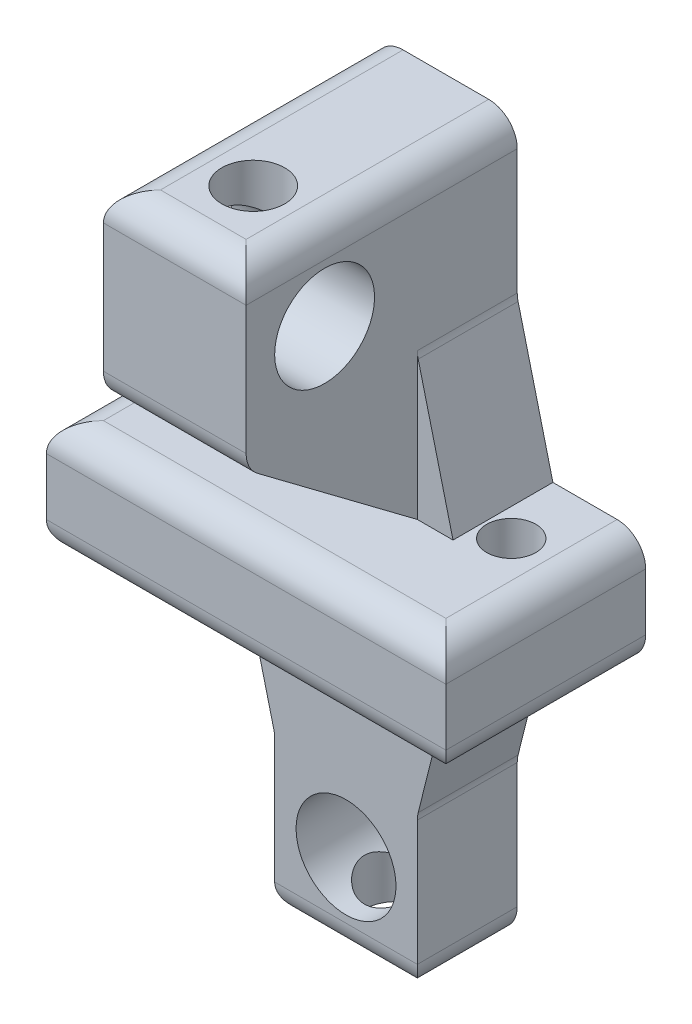
from build123d import *

# Parameters (mm, degrees)
SKETCH4_W                      = 5
SKETCH4_H                      = 3.5
BOSS_EXTRUDE4_DEPTH            = 25
SKETCH8_W                      = 5
SKETCH8_H                      = 6
BOSS_EXTRUDE6_DEPTH            = 6
BOSS_EXTRUDE8_DEPTH            = 7
BOSS_EXTRUDE8_DEPTH_BACK       = 7
SKETCH10_W                     = 7
SKETCH10_H                     = 4
CUT_EXTRUDE1_REACH             = 19.869
SKETCH11_R                     = 0.86
CUT_EXTRUDE3_REACH             = 29.094
SKETCH5_R                      = 1.75
CUT_EXTRUDE3_DIRECTION_2_REACH = 29.094
CUT_EXTRUDE2_REACH             = 29.094
SKETCH9_R                      = 1.75
CUT_EXTRUDE2_DIRECTION_2_REACH = 29.094
CUT_EXTRUDE4_REACH             = 29.094
CUT_EXTRUDE4_END_RADIUS        = 1.75
SKETCH13_R                     = 1.1
CUT_EXTRUDE5_REACH             = 29.094
CUT_EXTRUDE5_END_RADIUS        = 1.75
SKETCH14_R                     = 1.1
RIB5_REACH                     = 29.844
SKETCH19_WALL_W                = 65.188868008
SKETCH19_WALL_H                = 5
RIB8_REACH                     = 29.645
SKETCH20_WALL_W                = 62.444026
SKETCH20_WALL_H                = 3.5
RIB9_REACH                     = 29.645
SKETCH21_WALL_W                = 62.444026
SKETCH21_WALL_H                = 3.5
FILLET2_R                      = 1


with BuildPart() as part:
    # Sketch4 → Boss-Extrude4 (new body)
    with BuildSketch(Plane(origin=(0, 0, 0), x_dir=(1, 0, 0), z_dir=(0, 1, 0))):
        Rectangle(SKETCH4_W, SKETCH4_H)
    extrude(amount=BOSS_EXTRUDE4_DEPTH)

    # Sketch8 → Boss-Extrude6 (add)
    with BuildSketch(Plane.XY.offset(1.75)):
        with Locations((0, 22)):
            Rectangle(SKETCH8_W, SKETCH8_H)
    extrude(amount=BOSS_EXTRUDE6_DEPTH)

    # Sketch10 → Boss-Extrude8 (add, two sides: drawn at the far end of the back side and taken through both)
    with BuildSketch(Plane(origin=(0, 0, 0), x_dir=(0, 0, -1), z_dir=(1, 0, 0)).offset(-BOSS_EXTRUDE8_DEPTH_BACK)):
        with Locations((-1.75, 12.5)):
            Rectangle(SKETCH10_W, SKETCH10_H)
    extrude(amount=BOSS_EXTRUDE8_DEPTH + BOSS_EXTRUDE8_DEPTH_BACK)

    # Sketch11 → Cut-Extrude1 (cut, up to next)
    with BuildSketch(Plane.XZ.offset(-10.5), mode=Mode.PRIVATE) as cut_extrude1_sk1:
        with Locations(Location((-5.3, 2.3, 0), (0, 0, 270))):
            Circle(SKETCH11_R)
    cut_extrude1_tool1 = extrude(cut_extrude1_sk1.sketch, amount=-CUT_EXTRUDE1_REACH, mode=Mode.PRIVATE) & part.part
    # Sketch11 → Cut-Extrude1 (cut, up to next)
    with BuildSketch(Plane.XZ.offset(-10.5), mode=Mode.PRIVATE) as cut_extrude1_sk2:
        with Locations(Location((4.72, 0.68, 0), (0, 0, 270))):
            Circle(SKETCH11_R)
    cut_extrude1_tool2 = extrude(cut_extrude1_sk2.sketch, amount=-CUT_EXTRUDE1_REACH, mode=Mode.PRIVATE) & part.part
    add(cut_extrude1_tool1.solids().sort_by_distance((-5.3, 10.5, 2.3))[0], mode=Mode.SUBTRACT)
    add(cut_extrude1_tool2.solids().sort_by_distance((4.72, 10.5, 0.68))[0], mode=Mode.SUBTRACT)

    # Sketch5 → Cut-Extrude3 (cut, up to next)
    with BuildSketch(Plane.XY, mode=Mode.PRIVATE) as cut_extrude3_sk1:
        with Locations(Location((0, 3, 0), (0, 0, 180))):
            Circle(SKETCH5_R)
    cut_extrude3_tool1 = extrude(cut_extrude3_sk1.sketch, amount=-CUT_EXTRUDE3_REACH, mode=Mode.PRIVATE) & part.part
    add(cut_extrude3_tool1.solids().sort_by_distance((0, 3, 0))[0], mode=Mode.SUBTRACT)

    # Sketch5 → Cut-Extrude3 direction 2 (cut, up to next)
    with BuildSketch(Plane.XY, mode=Mode.PRIVATE) as cut_extrude3_direction_2_sk1:
        with Locations(Location((0, 3, 0), (0, 0, 180))):
            Circle(SKETCH5_R)
    cut_extrude3_direction_2_tool1 = extrude(cut_extrude3_direction_2_sk1.sketch, amount=CUT_EXTRUDE3_DIRECTION_2_REACH, mode=Mode.PRIVATE) & part.part
    add(cut_extrude3_direction_2_tool1.solids().sort_by_distance((0, 3, 0))[0], mode=Mode.SUBTRACT)

    # Sketch9 → Cut-Extrude2 (cut, up to next)
    with BuildSketch(Plane.ZY, mode=Mode.PRIVATE) as cut_extrude2_sk1:
        with Locations((5, 22)):
            Circle(SKETCH9_R)
    cut_extrude2_tool1 = extrude(cut_extrude2_sk1.sketch, amount=CUT_EXTRUDE2_REACH, mode=Mode.PRIVATE) & part.part
    add(cut_extrude2_tool1.solids().sort_by_distance((0, 22, 5))[0], mode=Mode.SUBTRACT)

    # Sketch9 → Cut-Extrude2 direction 2 (cut, up to next)
    with BuildSketch(Plane.ZY, mode=Mode.PRIVATE) as cut_extrude2_direction_2_sk1:
        with Locations((5, 22)):
            Circle(SKETCH9_R)
    cut_extrude2_direction_2_tool1 = extrude(cut_extrude2_direction_2_sk1.sketch, amount=-CUT_EXTRUDE2_DIRECTION_2_REACH, mode=Mode.PRIVATE) & part.part
    add(cut_extrude2_direction_2_tool1.solids().sort_by_distance((0, 22, 5))[0], mode=Mode.SUBTRACT)

    # Cut-Extrude4: up to this cylinder (the profile starts outside it)
    cut_extrude4_end = Plane(origin=(0, 22, 5), z_dir=(-1, 0, 0)) * Cylinder(CUT_EXTRUDE4_END_RADIUS, 62.688, mode=Mode.PRIVATE)
    # Sketch13 → Cut-Extrude4 (cut, up to the surface)
    with BuildSketch(Plane(origin=(0, 25, 0), x_dir=(1, 0, 0), z_dir=(0, 1, 0)), mode=Mode.PRIVATE) as cut_extrude4_sk1:
        with Locations(Location((0, -5, 0), (0, 0, 270))):
            Circle(SKETCH13_R)
    cut_extrude4_tool1 = extrude(cut_extrude4_sk1.sketch, amount=-CUT_EXTRUDE4_REACH, mode=Mode.PRIVATE) - cut_extrude4_end
    add(cut_extrude4_tool1.solids().sort_by_distance((0, 25, 5))[0], mode=Mode.SUBTRACT)

    # Cut-Extrude5: up to this cylinder (the profile starts outside it)
    cut_extrude5_end = Plane(origin=(0, 3, 0), z_dir=(0, 0, -1)) * Cylinder(CUT_EXTRUDE5_END_RADIUS, 62.688, mode=Mode.PRIVATE)
    # Sketch14 → Cut-Extrude5 (cut, up to the surface)
    with BuildSketch(Plane.XZ, mode=Mode.PRIVATE) as cut_extrude5_sk1:
        with Locations(Location((0, 0, 0), (0, 0, 270))):
            Circle(SKETCH14_R)
    cut_extrude5_tool1 = extrude(cut_extrude5_sk1.sketch, amount=-CUT_EXTRUDE5_REACH, mode=Mode.PRIVATE) - cut_extrude5_end
    add(cut_extrude5_tool1.solids().sort_by_distance((0, 0, 0))[0], mode=Mode.SUBTRACT)

    # Sketch19 wall → Rib5 (add, up to next)
    with BuildSketch(Plane(origin=(-2.5, 16.75, 4.75), x_dir=(0, 0.6, 0.8), z_dir=(0, 0.8, -0.6)), mode=Mode.PRIVATE) as rib5_sk1:
        with Locations((0, 2.5)):
            Rectangle(SKETCH19_WALL_W, SKETCH19_WALL_H)
    rib5_tool1 = extrude(rib5_sk1.sketch, amount=RIB5_REACH, mode=Mode.PRIVATE) - part.part
    add(rib5_tool1.solids().sort_by_distance((-2.5, 16.75, 4.75))[0])

    # Sketch20 wall → Rib8 (add, up to next)
    with BuildSketch(Plane(origin=(-3.125, 17, -1.75), x_dir=(-0.242535625036, -0.970142500145, 0), z_dir=(-0.970142500145, 0.242535625036, 0)), mode=Mode.PRIVATE) as rib8_sk1:
        with Locations((0, 1.75)):
            Rectangle(SKETCH20_WALL_W, SKETCH20_WALL_H)
    rib8_tool1 = extrude(rib8_sk1.sketch, amount=-RIB8_REACH, mode=Mode.PRIVATE) - part.part
    rib8 = rib8_tool1.solids().sort_by_distance((-3.125, 17, -1.75))[0]
    add(rib8)

    # Sketch21 wall → Rib9 (add, up to next)
    with BuildSketch(Plane(origin=(-3.125, 8, -1.75), x_dir=(0.242535625036, -0.970142500145, 0), z_dir=(-0.970142500145, -0.242535625036, 0)), mode=Mode.PRIVATE) as rib9_sk1:
        with Locations((0, 1.75)):
            Rectangle(SKETCH21_WALL_W, SKETCH21_WALL_H)
    rib9_tool1 = extrude(rib9_sk1.sketch, amount=-RIB9_REACH, mode=Mode.PRIVATE) - part.part
    rib9 = rib9_tool1.solids().sort_by_distance((-3.125, 8, -1.75))[0]
    add(rib9)

    # Mirror3: Rib8, Rib9 across plane
    add(rib8.mirror(Plane(origin=(0, 0, 0), x_dir=(0, 0, 1), z_dir=(1, 0, 0))))
    add(rib9.mirror(Plane(origin=(0, 0, 0), x_dir=(0, 0, 1), z_dir=(1, 0, 0))))

    # Fillet2
    # the kernel refuses this fillet: 1 mm, written as the material it adds along each edge
    with BuildSketch(Plane(origin=(-2.5, 19.5, 1.75), x_dir=(-0.2425356250360274, -0.9701425001454083, 0), z_dir=(0, 0, -1)), Plane(origin=(-2.5, 5.5, -1.75), x_dir=(-0.24253562503611567, 0.9701425001453862, 0), z_dir=(0, 0, 1)), Plane(origin=(2.5, 5.5, -1.75), x_dir=(0, -1, 0), z_dir=(0, 0, 1))) as fillet2_piece_1:
        with BuildLine():
            CenterArc((FILLET2_R * 0.123105625617, FILLET2_R), FILLET2_R, 255.963756532, 14.036243468)
            Line((-FILLET2_R * 0.119429999419, FILLET2_R * 0.0298574998546), (0, 0))
            Line((0, 0), (FILLET2_R * 0.123105625618, 0))
        make_face()
    fillet2_piece_1_solid = extrude(amount=3.5, mode=Mode.PRIVATE)
    with BuildSketch(Plane(origin=(2.5, 19.5, 1.75), x_dir=(0.24253562503603418, -0.9701425001454065, 0), z_dir=(0, 0, -1))) as fillet2_piece_2:
        with BuildLine():
            CenterArc((FILLET2_R * 0.123105625617, -FILLET2_R), FILLET2_R, 90, 14.036243468)
            Line((-FILLET2_R * 0.119429999419, -FILLET2_R * 0.0298574998546), (0, 0))
            Line((0, 0), (FILLET2_R * 0.123105625618, 0))
        make_face()
    fillet2_piece_2_solid = extrude(amount=3.5, mode=Mode.PRIVATE)
    add([fillet2_piece_1_solid, fillet2_piece_2_solid])
    # the kernel refuses this fillet: 1 mm, written as the material it takes off along each edge
    with BuildSketch(Plane(origin=(-2.5, 25, 10.25), x_dir=(0, -1, 0), z_dir=(0, 0, -1)), Plane(origin=(2.5, 25, -4.25), x_dir=(0, -1, 0), z_dir=(0, 0, 1))) as fillet2_2_piece_1:
        with BuildLine():
            CenterArc((FILLET2_R, -FILLET2_R), FILLET2_R, 90, 90)
            Line((0, -FILLET2_R), (0, 0))
            Line((0, 0), (FILLET2_R, 0))
        make_face()
    fillet2_2_piece_1_solid = extrude(amount=14.5, mode=Mode.PRIVATE)
    with BuildSketch(Plane(origin=(3.75, 19, 7.75), x_dir=(0, -0.5999999999999996, -0.8000000000000002), z_dir=(-1, 0, 0))) as fillet2_2_piece_2:
        with BuildLine():
            CenterArc((FILLET2_R * 0.5, -FILLET2_R), FILLET2_R, 90, 53.130102354)
            Line((-FILLET2_R * 0.3, -FILLET2_R * 0.4), (0, 0))
            Line((0, 0), (FILLET2_R * 0.5, 0))
        make_face()
    fillet2_2_piece_2_solid = extrude(amount=7.5, mode=Mode.PRIVATE)
    with BuildSketch(Plane(origin=(-5, 25, 7.75), x_dir=(0, 0, -1), z_dir=(1, 0, 0)), Plane(origin=(-5, 0, 1.75), x_dir=(0, 1, 0), z_dir=(1, 0, 0))) as fillet2_2_piece_3:
        with BuildLine():
            CenterArc((FILLET2_R, -FILLET2_R), FILLET2_R, 90, 90)
            Line((0, -FILLET2_R), (0, 0))
            Line((0, 0), (FILLET2_R, 0))
        make_face()
    fillet2_2_piece_3_solid = extrude(amount=10, mode=Mode.PRIVATE)
    with BuildSketch(Plane(origin=(-7, 14.5, -4.25), x_dir=(0, -1, 0), z_dir=(0, 0, 1)), Plane(origin=(7, 10.5, 7.75), x_dir=(-1, 0, 0), z_dir=(0, 0, -1))) as fillet2_2_piece_4:
        with BuildLine():
            CenterArc((FILLET2_R, FILLET2_R), FILLET2_R, 180, 90)
            Line((0, FILLET2_R), (0, 0))
            Line((0, 0), (FILLET2_R, 0))
        make_face()
    fillet2_2_piece_4_solid = extrude(amount=12, mode=Mode.PRIVATE)
    with BuildSketch(Plane(origin=(9.5, 10.5, 5.25), x_dir=(0, 0, -1), z_dir=(-1, 0, 0)), Plane(origin=(9.5, 14.5, 5.25), x_dir=(0, -1, 0), z_dir=(-1, 0, 0))) as fillet2_2_piece_5:
        with BuildLine():
            CenterArc((FILLET2_R, -FILLET2_R), FILLET2_R, 90, 90)
            Line((0, -FILLET2_R), (0, 0))
            Line((0, 0), (FILLET2_R, 0))
        make_face()
    fillet2_2_piece_5_solid = extrude(amount=19, mode=Mode.PRIVATE)
    with BuildSketch(Plane(origin=(-7, 10.5, 7.75), x_dir=(1, 0, 0), z_dir=(0, 0, -1)), Plane(origin=(7, 14.5, -4.25), x_dir=(0, -1, 0), z_dir=(0, 0, 1))) as fillet2_2_piece_6:
        with BuildLine():
            CenterArc((FILLET2_R, -FILLET2_R), FILLET2_R, 90, 90)
            Line((0, -FILLET2_R), (0, 0))
            Line((0, 0), (FILLET2_R, 0))
        make_face()
    fillet2_2_piece_6_solid = extrude(amount=12, mode=Mode.PRIVATE)
    with BuildSketch(Plane(origin=(-2.5, 0, -4.25), x_dir=(1, 0, 0), z_dir=(0, 0, 1)), Plane(origin=(2.5, 0, 4.25), x_dir=(-1, 0, 0), z_dir=(0, 0, -1))) as fillet2_2_piece_7:
        with BuildLine():
            CenterArc((FILLET2_R, FILLET2_R), FILLET2_R, 180, 90)
            Line((0, FILLET2_R), (0, 0))
            Line((0, 0), (FILLET2_R, 0))
        make_face()
    fillet2_2_piece_7_solid = extrude(amount=8.5, mode=Mode.PRIVATE)
    add([fillet2_2_piece_1_solid, fillet2_2_piece_2_solid, fillet2_2_piece_3_solid, fillet2_2_piece_4_solid, fillet2_2_piece_5_solid, fillet2_2_piece_6_solid, fillet2_2_piece_7_solid], mode=Mode.SUBTRACT)


solid = part.part
